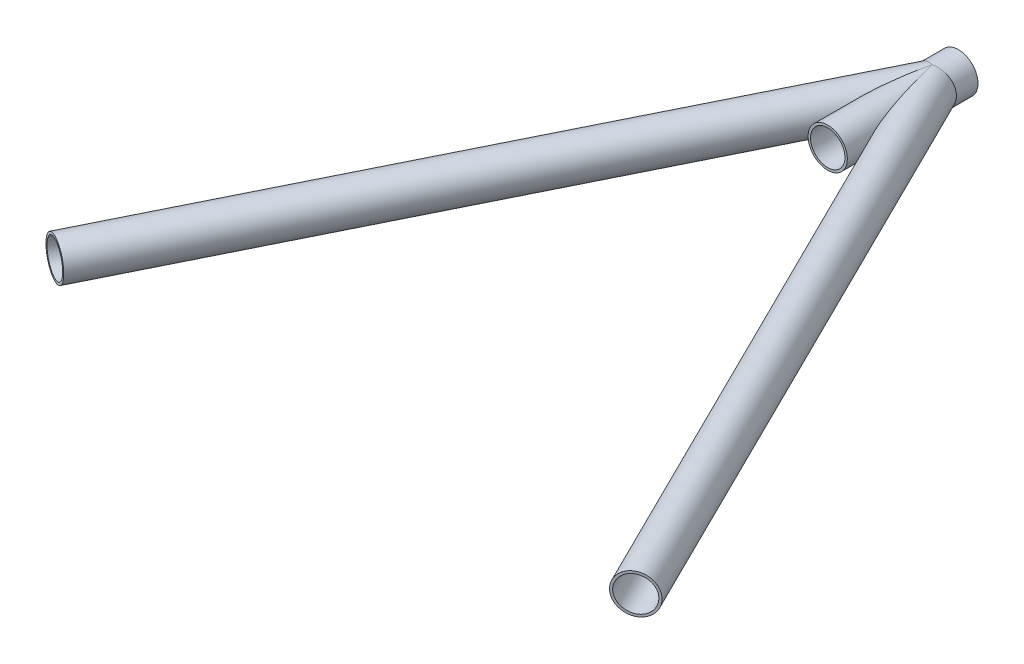
from build123d import *

# Parameters (mm, degrees)
SKETCH2_R               = 9.525
SKETCH2_R_2             = 8.382
BOSS_EXTRUDE1_DEPTH     = 63.5
SWEEP_THIN2_OUTLINE_W   = 1.143
SWEEP_THIN2_OUTLINE_H   = 318.219499774
SWEEP_THIN4_PROFILE_R   = 9.525
SWEEP_THIN4_PROFILE_R_2 = 8.382


# Read off the part's stored shape, not the designer's step: Sweep-Thin2
with BuildPart() as part:
    # Sketch2 → Boss-Extrude1 (new body)
    with BuildSketch(Plane.XY.offset(25.4)):
        Circle(SKETCH2_R)
        Circle(SKETCH2_R_2, mode=Mode.SUBTRACT)
    extrude(amount=BOSS_EXTRUDE1_DEPTH)

    # Sweep-Thin2 outline → Sweep-Thin2 (revolve)
    with BuildSketch(Plane(origin=(-15.145018356, 0, 7.494442073), x_dir=(0.8962675290618558, 0, -0.443513828814114), z_dir=(0, -1, 0))):
        with Locations((8.9535, 193.257542744)):
            Rectangle(SWEEP_THIN2_OUTLINE_W, SWEEP_THIN2_OUTLINE_H)
    revolve(axis=Axis((-15.145018356, 0, 7.494442073), (0.443513828814114, 0, 0.8962675290618558)))

    # Sweep-Thin4: sweep along a path in Sketch46
    with BuildLine(Plane(origin=(0, 0, 0), x_dir=(1, 0, 0), z_dir=(0, 1, 0))) as sweep_thin4_path:
        Line((0, -38.1), (-141.134748748, -323.309804762))
    # Sweep-Thin4 profile (on start of the path) → Sweep-Thin4 (sweep)
    with BuildSketch(Plane(origin=(0, 0, 38.1), x_dir=(0.8962675290618559, 0, 0.4435138288141142), z_dir=(-0.4435138288141142, 0, 0.8962675290618559))):
        Circle(SWEEP_THIN4_PROFILE_R)
        Circle(SWEEP_THIN4_PROFILE_R_2, mode=Mode.SUBTRACT)
    sweep(path=sweep_thin4_path.line)


solid = part.part
